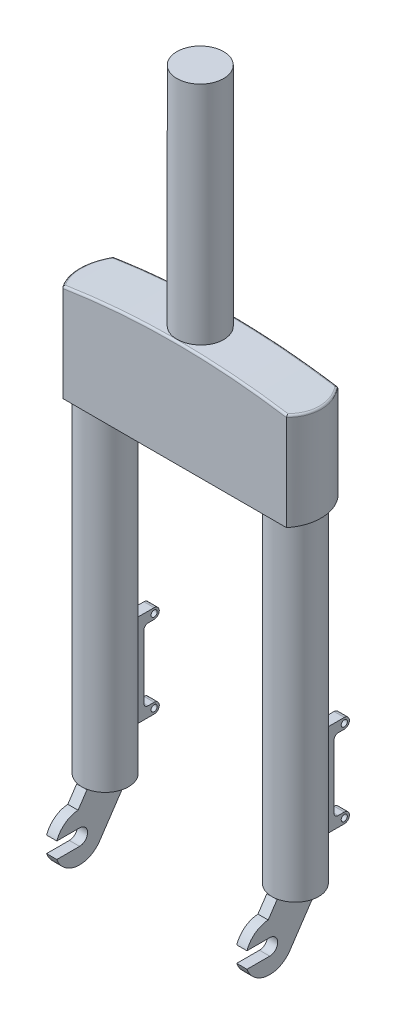
from build123d import *

# Parameters (mm, degrees)
SKETCH1_W           = 149.86
SKETCH1_H           = 31.75
SKETCH1_R           = 14.478
BOSS_EXTRUDE1_DEPTH = 36.068
CUT_EXTRUDE1_REACH  = 91.014
CUT_EXTRUDE2_START  = -36.068
CUT_EXTRUDE2_DEPTH  = 60.34531315
FILLET4_R           = 1.27
BOSS_EXTRUDE2_START = -36.068
SKETCH1_3_R         = 14.478
BOSS_EXTRUDE2_DEPTH = 205.739999
SKETCH6_R           = 14.478
BOSS_EXTRUDE4_DEPTH = 203.962
BOSS_EXTRUDE5_DEPTH = 3.175
SKETCH15_R          = 1.905
BOSS_EXTRUDE7_DEPTH = 3.175


# Read off the part's stored shape, not the designer's step: Cut-Extrude2
with BuildPart() as part:
    # Sketch1 → Boss-Extrude1 (new, symmetric)
    with BuildSketch(Plane(origin=(0, 0, 0), x_dir=(1, 0, 0), z_dir=(0, 1, 0))):
        Rectangle(SKETCH1_W, SKETCH1_H)
        with Locations(Location((0, 0, 0), (0, 0, 270))):
            Circle(SKETCH1_R, mode=Mode.SUBTRACT)
    extrude(amount=BOSS_EXTRUDE1_DEPTH, both=True)

    # Sketch2 → Cut-Extrude1 (cut, up to next)
    with BuildSketch(Plane.XY.offset(15.875), mode=Mode.PRIVATE) as cut_extrude1_sk1:
        with BuildLine():
            Line((74.93, 36.068), (74.93, 23.368))
            add(Edge.make_bspline(
                [(-74.93, 23.368), (0, 36.068), (74.93, 23.368)],
                knots=[0, 0, 0, 1, 1, 1], degree=2))
            Line((-74.93, 23.368), (-74.93, 36.068))
            Line((-74.93, 36.068), (74.93, 36.068))
        make_face()
    cut_extrude1_tool1 = extrude(cut_extrude1_sk1.sketch, amount=-CUT_EXTRUDE1_REACH, mode=Mode.PRIVATE) & part.part
    add(cut_extrude1_tool1.solids().sort_by_distance((0, 31.623, 15.875))[0], mode=Mode.SUBTRACT)

    # Cut-Extrude2 outline → Cut-Extrude2 (cut)
    with BuildSketch(Plane(origin=(0, 0, 0), x_dir=(1, 0, 0), z_dir=(0, 1, 0)).offset(CUT_EXTRUDE2_START)):
        with BuildLine():
            Line((74.93, 15.875), (69.357868645, 15.875))
            ThreePointArc((69.357868645, 15.875), (73.496516889, 8.412257022), (74.93, 0))
            Line((74.93, 0), (74.93, 15.875))
        make_face()
        with BuildLine():
            Line((74.93, -15.875), (74.93, 0))
            ThreePointArc((74.93, 0), (73.496516889, -8.412257022), (69.357868645, -15.875))
            Line((69.357868645, -15.875), (74.93, -15.875))
        make_face()
        with BuildLine():
            ThreePointArc((-74.93, 0), (-73.496516889, 8.412257022), (-69.357868645, 15.875))
            Line((-69.357868645, 15.875), (-74.93, 15.875))
            Line((-74.93, 15.875), (-74.93, 0))
        make_face()
        with BuildLine():
            ThreePointArc((-69.357868645, -15.875), (-73.496516889, -8.412257022), (-74.93, 0))
            Line((-74.93, 0), (-74.93, -15.875))
            Line((-74.93, -15.875), (-69.357868645, -15.875))
        make_face()
    extrude(amount=CUT_EXTRUDE2_DEPTH, mode=Mode.SUBTRACT)

    # Fillet4
    fillet4_edges = [part.edges().sort_by_distance(p)[0] for p in [
        (0, 29.718, 15.875),
        (73.49283923, 23.609250571, 8.422727374),
        (73.49283923, 23.609250571, -8.422727374),
        (0, 29.718, -15.875),
        (-73.49283923, 23.609250571, -8.422727374),
        (-73.49283923, 23.609250571, 8.422727374),
    ]]
    fillet(fillet4_edges, radius=FILLET4_R)

    # Sketch1<3> → Boss-Extrude2 (add)
    with BuildSketch(Plane(origin=(0, 0, 0), x_dir=(1, 0, 0), z_dir=(0, 1, 0)).offset(BOSS_EXTRUDE2_START)):
        with Locations(Location((0, 0, 0), (0, 0, 180))):
            Circle(SKETCH1_3_R)
    extrude(amount=BOSS_EXTRUDE2_DEPTH)

    # Sketch6 → Boss-Extrude4 (add)
    with BuildSketch(Plane.XZ.offset(36.068)):
        with Locations(Location((-58.928, 0, 0), (0, 0, 90))):
            Circle(SKETCH6_R)
        with Locations(Location((58.928, 0, 0), (0, 0, 90))):
            Circle(SKETCH6_R)
    extrude(amount=BOSS_EXTRUDE4_DEPTH)

    # Sketch7 → Boss-Extrude5 (add, symmetric)
    with BuildSketch(Plane.ZY.offset(-58.928)):
        with BuildLine():
            Line((14.478, -240.03), (19.987746324, -248.231647743))
            ThreePointArc((19.987746324, -248.231647743), (28.067098957, -251.22974197), (33.147, -258.191))
            Line((33.147, -258.191), (19.05, -258.191))
            ThreePointArc((19.05, -258.191), (14.097, -263.144), (19.05, -268.097))
            Line((19.05, -268.097), (33.147, -268.097))
            ThreePointArc((33.147, -268.097), (20.939990792, -277.965793171), (6.64704345, -271.476123787))
            Line((6.64704345, -271.476123787), (-14.478, -240.03))
            Line((-14.478, -240.03), (14.478, -240.03))
        make_face()
    boss_extrude5 = extrude(amount=BOSS_EXTRUDE5_DEPTH, both=True)

    # Mirror1: Boss-Extrude5 across plane
    add(boss_extrude5.mirror(Plane(origin=(0, 0, 0), x_dir=(0, 0, 1), z_dir=(1, 0, 0))))

    # Sketch15 → Boss-Extrude7 (add, symmetric)
    with BuildSketch(Plane.ZY.offset(-58.928)):
        with BuildLine():
            Line((-27.178, -169.418), (-23.368, -169.418))
            ThreePointArc((-23.368, -169.418), (-21.571948776, -170.161948776), (-20.828, -171.958))
            Line((-20.828, -171.958), (-20.828, -211.328))
            ThreePointArc((-20.828, -211.328), (-21.571948776, -213.124051224), (-23.368, -213.868))
            Line((-23.368, -213.868), (-27.178, -213.868))
            ThreePointArc((-27.178, -213.868), (-30.353, -217.043), (-27.178, -220.218))
            Line((-27.178, -220.218), (-9.677635342, -220.218))
            Line((-9.677635342, -220.218), (-9.677635342, -163.068))
            Line((-9.677635342, -163.068), (-27.178, -163.068))
            ThreePointArc((-27.178, -163.068), (-30.353, -166.243), (-27.178, -169.418))
        make_face()
        with Locations((-27.178, -166.243)):
            Circle(SKETCH15_R, mode=Mode.SUBTRACT)
        with Locations((-27.178, -217.043)):
            Circle(SKETCH15_R, mode=Mode.SUBTRACT)
    boss_extrude7 = extrude(amount=BOSS_EXTRUDE7_DEPTH, both=True)

    # Mirror15: Boss-Extrude7 across plane
    add(boss_extrude7.mirror(Plane(origin=(0, 0, 0), x_dir=(0, 0, 1), z_dir=(1, 0, 0))))


solid = part.part
